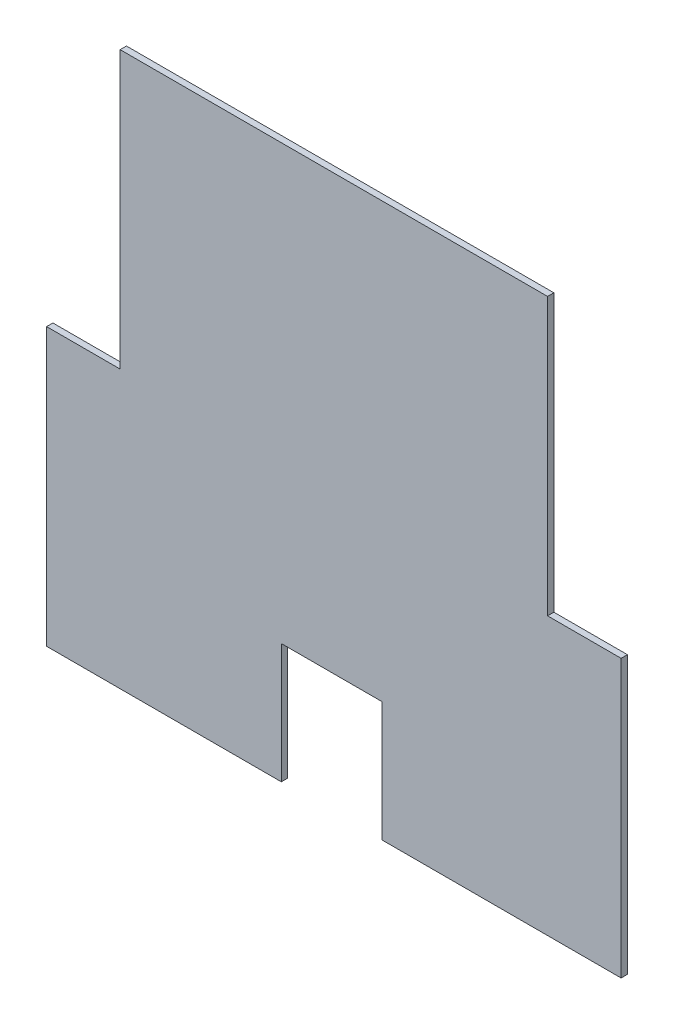
from build123d import *

# Parameters (mm, degrees)
SKETCH1_W           = 273.4
SKETCH1_H           = 263.4
BOSS_EXTRUDE1_DEPTH = 3
SKETCH2_W           = 35
SKETCH2_H           = 131.64
CUT_EXTRUDE1_DEPTH  = 380.652630703
SKETCH3_W           = 48
SKETCH3_H           = 57
CUT_EXTRUDE2_DEPTH  = 380.652630703


with BuildPart() as part:
    # Sketch1 → Boss-Extrude1 (new body)
    with BuildSketch(Plane.XY):
        with Locations((136.7, -131.7)):
            Rectangle(SKETCH1_W, SKETCH1_H)
    extrude(amount=BOSS_EXTRUDE1_DEPTH)

    # Sketch2 → Cut-Extrude1 (cut, through all)
    with BuildSketch(Plane.XY.offset(3)):
        with Locations((17.5, -65.82)):
            Rectangle(SKETCH2_W, SKETCH2_H)
        with Locations((255.9, -65.82)):
            Rectangle(SKETCH2_W, SKETCH2_H)
    extrude(amount=-CUT_EXTRUDE1_DEPTH, mode=Mode.SUBTRACT)

    # Sketch3 → Cut-Extrude2 (cut, through all)
    with BuildSketch(Plane(origin=(0, 0, 0), x_dir=(-1, 0, 0), z_dir=(0, 0, -1))):
        with Locations((-135.7, -234.9)):
            Rectangle(SKETCH3_W, SKETCH3_H)
    extrude(amount=-CUT_EXTRUDE2_DEPTH, mode=Mode.SUBTRACT)


solid = part.part
